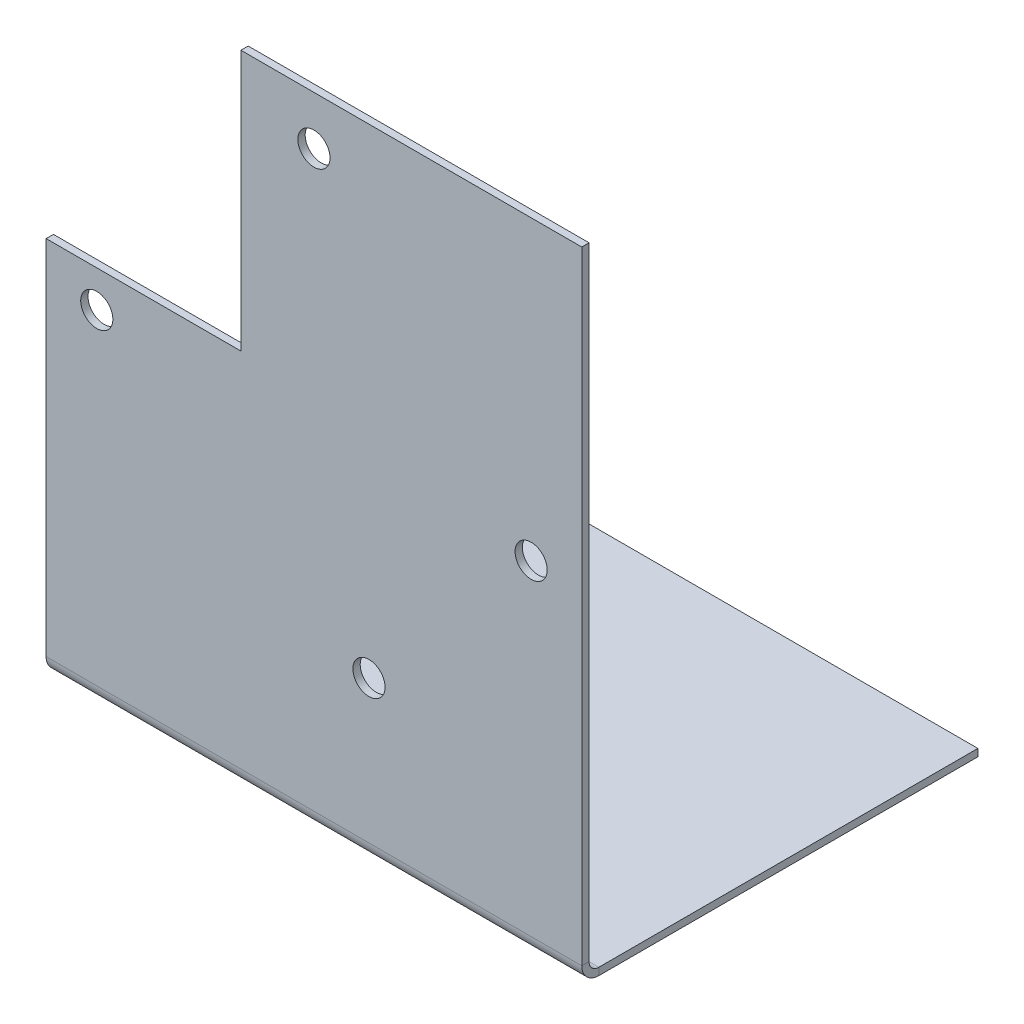
from build123d import *

# Parameters (mm, degrees)
ESBO_O1_W                   = 110
ESBO_O1_H                   = 210
RESSALTO_EXTRUS_O1_DEPTH    = 1.5
FURO_COM_FOLGA_DE_M62_D     = 6.6
FURO_COM_FOLGA_DE_M62_DEPTH = 10
FURO_COM_FOLGA_DE_M62_TIP   = 1.982840043
ESBO_O4_W                   = 40
ESBO_O4_H                   = 53.5
CORTE_EXTRUS_O1_DEPTH       = 119.542186584
DOBRA_START                 = -55
DOBRA_ESBO_ADA1_DEPTH       = 110
DOBRA_ESBO_ADA1_2_DEPTH     = 110


# Read off the part's stored shape, not the designer's step: Transforma__o de esbo_o2
with BuildPart() as part:
    # Esboço1 → Ressalto-extrusão1 (new body)
    with BuildSketch(Plane.XY):
        Rectangle(ESBO_O1_W, ESBO_O1_H)
    extrude(amount=RESSALTO_EXTRUS_O1_DEPTH)

    # Furo com folga de M62
    with Locations(Plane.XY.offset(1.5)):
        with Locations((0, 95), (-44.6, 44), (44.6, 44), (11.3, 6.5)):
            Hole(FURO_COM_FOLGA_DE_M62_D / 2, depth=FURO_COM_FOLGA_DE_M62_DEPTH)
            with Locations((0, 0, -(FURO_COM_FOLGA_DE_M62_DEPTH + FURO_COM_FOLGA_DE_M62_TIP / 2))):  # 118° drill point
                Cone(0, FURO_COM_FOLGA_DE_M62_D / 2, FURO_COM_FOLGA_DE_M62_TIP, mode=Mode.SUBTRACT)

    # Esboço4 → Corte-extrusão1 (cut, through all)
    with BuildSketch(Plane.XY.offset(1.5)):
        with Locations((-35, 78.25)):
            Rectangle(ESBO_O4_W, ESBO_O4_H)
    extrude(amount=-CORTE_EXTRUS_O1_DEPTH, mode=Mode.SUBTRACT)

    # Dobra esboçada1 outline → Dobra esboçada1 (cut)
    with BuildSketch(Plane.YZ.offset(DOBRA_START)):
        with BuildLine():
            Line((-105, 0), (-25.712436374, 0))
            ThreePointArc((-25.712436374, 0), (-24.460340225, 1.102418411), (-22.840155051, 1.5))
            Line((-22.840155051, 1.5), (-105, 1.5))
            Line((-105, 1.5), (-105, 0))
        make_face()
    extrude(amount=DOBRA_ESBO_ADA1_DEPTH, mode=Mode.SUBTRACT)

    # Dobra esbo_ada1 2 outline → Dobra esbo_ada1 2 (add)
    with BuildSketch(Plane.YZ.offset(DOBRA_START)):
        with BuildLine():
            ThreePointArc((-25.712436374, 0), (-26.179540071, -0.951902827), (-26.340155051, -2))
            Line((-26.340155051, -2), (-26.340155051, -79.840155051))
            Line((-26.340155051, -79.840155051), (-24.840155051, -79.840155051))
            Line((-24.840155051, -79.840155051), (-24.840155051, -2))
            ThreePointArc((-24.840155051, -2), (-24.254368613, -0.585786438), (-22.840155051, 0))
            Line((-22.840155051, 0), (-25.712436374, 0))
        make_face()
    extrude(amount=DOBRA_ESBO_ADA1_2_DEPTH)


solid = part.part
